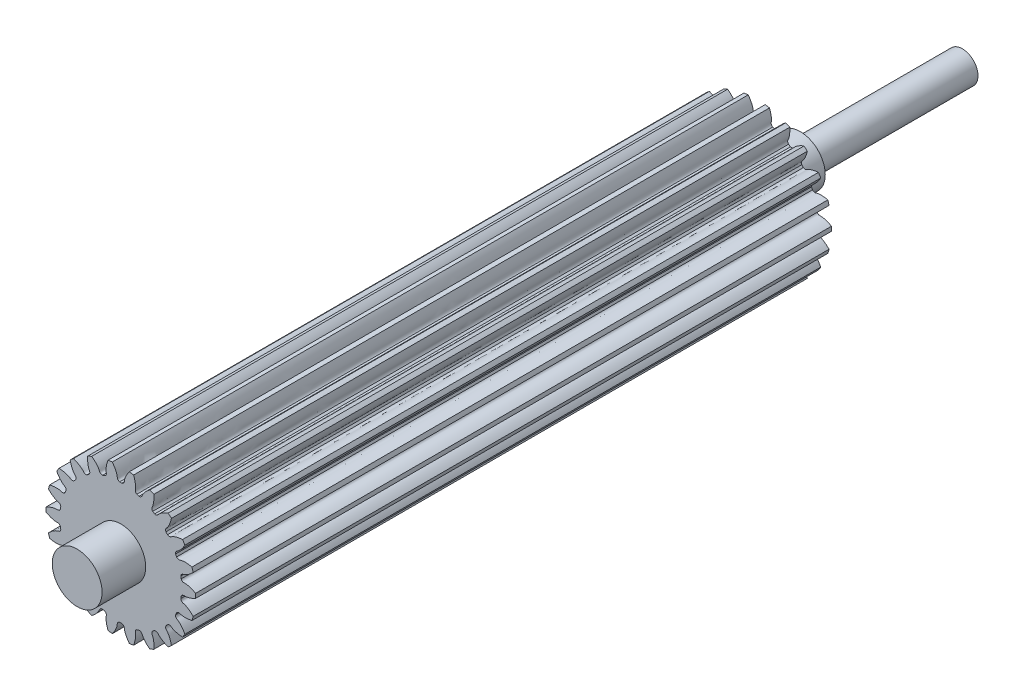
from build123d import *
from build123d.topology import SkipClean

# Parameters (mm, degrees)
SKETCH_1_R               = 12
EXTRUDE_1_DEPTH          = 30
CUT_EXTRUDE_1_DEPTH      = 35.467375879
PATTERN_CIRCULAR_1_COUNT = 22
EXTRUDE_START            = 72
EXTRUDE_2_DEPTH          = 72
SKETCH_19_R              = 4
EXTRUDE_3_DEPTH          = 7
EXTRUDE_START_2          = 7
SKETCH_20_R              = 4
EXTRUDE_4_DEPTH          = 7
SKETCH_21_R              = 2.5
EXTRUDE_5_DEPTH          = 26


with BuildPart() as part:
    # 草图1 → 凸台-拉伸1 (new body)
    with BuildSketch(Plane.XY):
        Circle(SKETCH_1_R)
    extrude(amount=EXTRUDE_1_DEPTH)

    # 草图2 → 切除-拉伸1 (cut, through all)
    with BuildSketch(Plane.XY):
        with BuildLine():
            ThreePointArc((0.185665431, 9.748232063), (0, 9.75), (-0.185665431, 9.748232063))
            add(Edge.make_bspline(
                [(-0.185665431, 9.748232063), (-0.588158706, 9.876186429), (-0.548347264, 10.151774696), (-0.599584047, 10.42157039), (-0.60596118, 10.451918903), (-0.613876897, 10.486162213), (-0.623483721, 10.524250431), (-0.634939934, 10.566127653), (-0.648399943, 10.611733662), (-0.664017171, 10.661003439), (-0.681942991, 10.713867378), (-0.70232689, 10.77025128), (-0.72531626, 10.830076418), (-0.751056303, 10.893259589), (-0.779689902, 10.959713172), (-0.811357505, 11.029345185), (-0.846197011, 11.10205935), (-0.884343649, 11.177755162), (-0.925929868, 11.25632795), (-0.971085225, 11.337668957), (-1.019936271, 11.421665408), (-1.072606448, 11.508200591), (-1.129215979, 11.597153935), (-1.189881763, 11.688401095), (-1.254717274, 11.781814033), (-1.323832459, 11.877261111), (-1.397333644, 11.974607178), (-1.475323431, 12.073713662), (-1.557900608, 12.174438668), (-1.64516006, 12.276637076), (-1.737192673, 12.380160638), (-1.834085256, 12.484858081), (-1.935920447, 12.590575215), (-2.042776642, 12.697155033), (-2.154727905, 12.804437827), (-2.271843904, 12.912261294), (-2.394189822, 13.020460649), (-2.521826308, 13.128868741), (-2.654809363, 13.237316171), (-2.841488127, 13.383435539), (-2.986445715, 13.489968103), (-3.085558798, 13.559868128)],
                knots=[0, 0, 0, 0, 0.157021319, 0.162530984, 0.168888289, 0.176093235, 0.184145822, 0.19304605, 0.202793918, 0.213389427, 0.224832576, 0.237123367, 0.250261798, 0.264247869, 0.279081582, 0.294762935, 0.311291928, 0.328668563, 0.346892838, 0.365964754, 0.38588431, 0.406651508, 0.428266346, 0.450728824, 0.474038944, 0.498196704, 0.523202104, 0.549055146, 0.575755828, 0.603304151, 0.631700114, 0.660943719, 0.691034964, 0.721973849, 0.753760376, 0.786394543, 0.819876351, 0.854205799, 0.889382888, 0.925407618, 1, 1, 1, 1], degree=3))
            ThreePointArc((-3.085558798, 13.559868128), (0, 13.906498364), (3.085558798, 13.559868128))
            add(Edge.make_bspline(
                [(0.185665431, 9.748232063), (0.588158706, 9.876186429), (0.548347264, 10.151774696), (0.599584047, 10.42157039), (0.60596118, 10.451918903), (0.613876897, 10.486162213), (0.623483721, 10.524250431), (0.634939934, 10.566127653), (0.648399943, 10.611733662), (0.664017171, 10.661003439), (0.681942991, 10.713867378), (0.70232689, 10.77025128), (0.72531626, 10.830076418), (0.751056303, 10.893259589), (0.779689902, 10.959713172), (0.811357505, 11.029345185), (0.846197011, 11.10205935), (0.884343649, 11.177755162), (0.925929868, 11.25632795), (0.971085225, 11.337668957), (1.019936271, 11.421665408), (1.072606448, 11.508200591), (1.129215979, 11.597153935), (1.189881763, 11.688401095), (1.254717274, 11.781814033), (1.323832459, 11.877261111), (1.397333644, 11.974607178), (1.475323431, 12.073713662), (1.557900608, 12.174438668), (1.64516006, 12.276637076), (1.737192673, 12.380160638), (1.834085256, 12.484858081), (1.935920447, 12.590575215), (2.042776642, 12.697155033), (2.154727905, 12.804437827), (2.271843904, 12.912261294), (2.394189822, 13.020460649), (2.521826308, 13.128868741), (2.654809363, 13.237316171), (2.841488127, 13.383435539), (2.986445715, 13.489968103), (3.085558798, 13.559868128)],
                knots=[0, 0, 0, 0, 0.157021319, 0.162530984, 0.168888289, 0.176093235, 0.184145822, 0.19304605, 0.202793918, 0.213389427, 0.224832576, 0.237123367, 0.250261798, 0.264247869, 0.279081582, 0.294762935, 0.311291928, 0.328668563, 0.346892838, 0.365964754, 0.38588431, 0.406651508, 0.428266346, 0.450728824, 0.474038944, 0.498196704, 0.523202104, 0.549055146, 0.575755828, 0.603304151, 0.631700114, 0.660943719, 0.691034964, 0.721973849, 0.753760376, 0.786394543, 0.819876351, 0.854205799, 0.889382888, 0.925407618, 1, 1, 1, 1], degree=3))
        make_face()
    cut_extrude_1 = extrude(amount=CUT_EXTRUDE_1_DEPTH, mode=Mode.SUBTRACT)

    # 阵列(圆周)1: 切除-拉伸1 ×22 about axis
    pattern_circular_1_axis = Axis((0, 0, -1.5), (0, 0, 1))
    for i in range(1, PATTERN_CIRCULAR_1_COUNT):
        add(cut_extrude_1.rotate(pattern_circular_1_axis, i * 360 / PATTERN_CIRCULAR_1_COUNT), mode=Mode.SUBTRACT)

    # 草图4 → 凸台-拉伸2 (add)
    with BuildSketch(Plane(origin=(0, 0, 0), x_dir=(-1, 0, 0), z_dir=(0, 0, -1)).offset(EXTRUDE_START)):
        with BuildLine():
            ThreePointArc((2.924539021, 9.301052173), (2.746892429, 9.355056493), (2.568249667, 9.405668166))
            add(Edge.make_bspline(
                [(2.568249667, 9.405668166), (2.218109108, 9.641834941), (2.333950094, 9.895043767), (2.361944393, 10.180005258), (2.365849304, 10.238460497), (2.368085913, 10.32113962), (2.366834845, 10.420382901), (2.360772595, 10.536017252), (2.34858845, 10.667790208), (2.32898426, 10.815370787), (2.300679804, 10.978350119), (2.26241667, 11.156242389), (2.212962422, 11.348485973), (2.151114634, 11.554444777), (2.096274933, 11.713680077), (2.062581682, 11.80433527), (2.055688884, 11.822611522)],
                knots=[0, 0, 0, 0, 0.157021319, 0.162530984, 0.176093235, 0.19304605, 0.213389427, 0.237123367, 0.264247869, 0.294762935, 0.328668563, 0.365964754, 0.406651508, 0.450728824, 0.498196704, 0.510209942, 0.510209942, 0.510209942, 0.510209942], degree=3))
            ThreePointArc((2.055688884, 11.822611522), (1.707778059, 11.877857303), (1.358395532, 11.922867171))
            add(Edge.make_bspline(
                [(1.358395532, 11.922867171), (1.300155371, 11.845656586), (1.201946581, 11.708817962), (1.073915974, 11.512256119), (0.972303664, 11.341732625), (0.885472389, 11.181826213), (0.812397844, 11.033422979), (0.752009469, 10.897343589), (0.703194045, 10.774341044), (0.670055832, 10.680054419), (0.644027119, 10.597938124), (0.627360159, 10.539619361), (0.611348785, 10.476138997), (0.60176986, 10.433080149), (0.548347264, 10.151774696), (0.588158706, 9.876186429), (0.185665431, 9.748232063)],
                knots=[0.489790058, 0.489790058, 0.489790058, 0.489790058, 0.549271176, 0.593348492, 0.634035246, 0.671331437, 0.705237065, 0.735752131, 0.762876633, 0.786610573, 0.797206082, 0.815854178, 0.823906765, 0.837469016, 0.842978681, 1, 1, 1, 1], degree=3))
            ThreePointArc((0.185665431, 9.748232063), (0, 9.75), (-0.185665431, 9.748232063))
            add(Edge.make_bspline(
                [(-0.185665431, 9.748232063), (-0.588158706, 9.876186429), (-0.548347264, 10.151774696), (-0.60176986, 10.433080149), (-0.61449187, 10.490267681), (-0.635639261, 10.570227844), (-0.664799714, 10.665098608), (-0.703194362, 10.774341023), (-0.752009695, 10.897343577), (-0.812398032, 11.033422968), (-0.885472542, 11.181826205), (-0.972303795, 11.341732617), (-1.073916075, 11.512256114), (-1.191283893, 11.692447604), (-1.288763969, 11.829782626), (-1.346632927, 11.907273161), (-1.358395532, 11.922867171)],
                knots=[0, 0, 0, 0, 0.157021319, 0.162530984, 0.176093235, 0.19304605, 0.213389427, 0.237123367, 0.264247869, 0.294762935, 0.328668563, 0.365964754, 0.406651508, 0.450728824, 0.498196704, 0.510209942, 0.510209942, 0.510209942, 0.510209942], degree=3))
            ThreePointArc((-1.358395532, 11.922867171), (-1.707778059, 11.877857303), (-2.055688884, 11.822611522))
            add(Edge.make_bspline(
                [(-2.055688884, 11.822611522), (-2.089817174, 11.732120359), (-2.145495923, 11.573156047), (-2.21296252, 11.34848595), (-2.262416797, 11.156242359), (-2.300679954, 10.978350084), (-2.328984444, 10.815370745), (-2.348588671, 10.667790156), (-2.360772906, 10.536017183), (-2.366005176, 10.436213716), (-2.36784471, 10.350090571), (-2.367406247, 10.289438503), (-2.364884562, 10.224018615), (-2.361944393, 10.180005258), (-2.333950094, 9.895043767), (-2.218109108, 9.641834941), (-2.568249667, 9.405668166)],
                knots=[0.489790058, 0.489790058, 0.489790058, 0.489790058, 0.549271176, 0.593348492, 0.634035246, 0.671331437, 0.705237065, 0.735752131, 0.762876633, 0.786610573, 0.797206082, 0.815854178, 0.823906765, 0.837469016, 0.842978681, 1, 1, 1, 1], degree=3))
            ThreePointArc((-2.568249667, 9.405668166), (-2.746892429, 9.355056493), (-2.924539021, 9.301052173))
            add(Edge.make_bspline(
                [(-2.924539021, 9.301052173), (-3.3467774, 9.310428028), (-3.386220788, 9.586069213), (-3.516732299, 9.840928935), (-3.545050567, 9.892215766), (-3.587868721, 9.962979072), (-3.642576155, 10.045791454), (-3.710192695, 10.139791761), (-3.791684488, 10.244058979), (-3.887964667, 10.357612838), (-3.999889169, 10.479417233), (-4.128253989, 10.608383121), (-4.273792278, 10.74337173), (-4.437171685, 10.883197863), (-4.569394878, 10.987506541), (-4.646751344, 11.045554595), (-4.662430821, 11.057203029)],
                knots=[0, 0, 0, 0, 0.157021319, 0.162530984, 0.176093235, 0.19304605, 0.213389427, 0.237123367, 0.264247869, 0.294762935, 0.328668563, 0.365964754, 0.406651508, 0.450728824, 0.498196704, 0.510209942, 0.510209942, 0.510209942, 0.510209942], degree=3))
            ThreePointArc((-4.662430821, 11.057203029), (-4.984980156, 10.915583944), (-5.303233613, 10.7645582))
            add(Edge.make_bspline(
                [(-5.303233613, 10.7645582), (-5.310485161, 10.668117515), (-5.319123107, 10.499905858), (-5.320559952, 10.265328941), (-5.313849705, 10.066939687), (-5.300444889, 9.885473322), (-5.281686262, 9.721121495), (-5.258918124, 9.573995807), (-5.233484075, 9.44412787), (-5.210386516, 9.346893044), (-5.187887842, 9.263740235), (-5.170379477, 9.205668531), (-5.149529026, 9.143609049), (-5.134307959, 9.102206883), (-5.027164697, 8.83667524), (-4.844678915, 8.626359328), (-5.114100451, 8.301112972)],
                knots=[0.489790058, 0.489790058, 0.489790058, 0.489790058, 0.549271176, 0.593348492, 0.634035246, 0.671331437, 0.705237065, 0.735752131, 0.762876633, 0.786610573, 0.797206082, 0.815854178, 0.823906765, 0.837469016, 0.842978681, 1, 1, 1, 1], degree=3))
            ThreePointArc((-5.114100451, 8.301112972), (-5.27124797, 8.202221945), (-5.426483851, 8.100356351))
            add(Edge.make_bspline(
                [(-5.426483851, 8.100356351), (-5.834260094, 7.99039412), (-5.949762843, 8.243757414), (-6.146790001, 8.451524185), (-6.188410351, 8.49275536), (-6.249430396, 8.548588987), (-6.325252738, 8.612634021), (-6.41661328, 8.683776874), (-6.524179553, 8.760861647), (-6.648551527, 8.842690515), (-6.790258564, 8.928028199), (-6.949757596, 9.015605514), (-7.127431248, 9.104123262), (-7.323586215, 9.192256156), (-7.479840591, 9.255088021), (-7.570417602, 9.288990887), (-7.588743694, 9.295750058)],
                knots=[0, 0, 0, 0, 0.157021319, 0.162530984, 0.176093235, 0.19304605, 0.213389427, 0.237123367, 0.264247869, 0.294762935, 0.328668563, 0.365964754, 0.406651508, 0.450728824, 0.498196704, 0.510209942, 0.510209942, 0.510209942, 0.510209942], degree=3))
            ThreePointArc((-7.588743694, 9.295750058), (-7.858328807, 9.068994892), (-8.121141894, 8.834424392))
            add(Edge.make_bspline(
                [(-8.121141894, 8.834424392), (-8.100929222, 8.739847235), (-8.061826571, 8.576015742), (-7.997117259, 8.350536032), (-7.934786112, 8.162073431), (-7.870799303, 7.991734302), (-7.806497272, 7.839324794), (-7.743201307, 7.704573257), (-7.68220949, 7.587131484), (-7.632653327, 7.500342686), (-7.587639155, 7.426896759), (-7.554479312, 7.376110043), (-7.516989274, 7.322438657), (-7.49072043, 7.287001839), (-7.313108313, 7.06241184), (-7.078761648, 6.912027385), (-7.245637231, 6.524050974)],
                knots=[0.489790058, 0.489790058, 0.489790058, 0.489790058, 0.549271176, 0.593348492, 0.634035246, 0.671331437, 0.705237065, 0.735752131, 0.762876633, 0.786610573, 0.797206082, 0.815854178, 0.823906765, 0.837469016, 0.842978681, 1, 1, 1, 1], degree=3))
            ThreePointArc((-7.245637231, 6.524050974), (-7.36855835, 6.384892156), (-7.488807233, 6.243417832))
            add(Edge.make_bspline(
                [(-7.488807233, 6.243417832), (-7.849085732, 6.023026001), (-8.031290497, 6.233585417), (-8.278871334, 6.377427208), (-8.330421932, 6.405262424), (-8.404700387, 6.441643063), (-8.495494963, 6.481732201), (-8.603198018, 6.52425403), (-8.728124391, 6.567911406), (-8.870512283, 6.611385996), (-9.030521594, 6.653343419), (-9.208233175, 6.692437167), (-9.403648127, 6.727312872), (-9.616687345, 6.756612524), (-9.784314102, 6.772877312), (-9.88077365, 6.77988838), (-9.900261685, 6.781210701)],
                knots=[0, 0, 0, 0, 0.157021319, 0.162530984, 0.176093235, 0.19304605, 0.213389427, 0.237123367, 0.264247869, 0.294762935, 0.328668563, 0.365964754, 0.406651508, 0.450728824, 0.498196704, 0.510209942, 0.510209942, 0.510209942, 0.510209942], degree=3))
            ThreePointArc((-9.900261685, 6.781210701), (-10.095042394, 6.487689809), (-10.281123557, 6.188578059))
            add(Edge.make_bspline(
                [(-10.281123557, 6.188578059), (-10.235084176, 6.103526509), (-10.151408791, 5.957347833), (-10.025795686, 5.759232356), (-9.912893339, 5.595964528), (-9.803508366, 5.450552498), (-9.698872299, 5.322432622), (-9.60017637, 5.210972003), (-9.508567979, 5.115470827), (-9.43656796, 5.046159169), (-9.372685068, 4.988370276), (-9.326560161, 4.948982987), (-9.275467756, 4.908047833), (-9.240279279, 4.881447244), (-9.006587387, 4.715993833), (-8.739365211, 4.637724091), (-8.790175575, 4.218449166)],
                knots=[0.489790058, 0.489790058, 0.489790058, 0.489790058, 0.549271176, 0.593348492, 0.634035246, 0.671331437, 0.705237065, 0.735752131, 0.762876633, 0.786610573, 0.797206082, 0.815854178, 0.823906765, 0.837469016, 0.842978681, 1, 1, 1, 1], degree=3))
            ThreePointArc((-8.790175575, 4.218449166), (-8.868911955, 4.050296377), (-8.94443199, 3.880674732))
            add(Edge.make_bspline(
                [(-8.94443199, 3.880674732), (-9.228025124, 3.567708136), (-9.462170759, 3.718405401), (-9.740247748, 3.786669007), (-9.797552271, 3.798853219), (-9.879071537, 3.812833528), (-9.97748271, 3.825718986), (-10.092802818, 3.836174925), (-10.2249685, 3.842868044), (-10.373836889, 3.844466303), (-10.53918547, 3.839644323), (-10.720712465, 3.827087362), (-10.91803736, 3.805495601), (-11.130701659, 3.773588328), (-11.296120675, 3.741968363), (-11.390648179, 3.721519639), (-11.409719353, 3.717297982)],
                knots=[0, 0, 0, 0, 0.157021319, 0.162530984, 0.176093235, 0.19304605, 0.213389427, 0.237123367, 0.264247869, 0.294762935, 0.328668563, 0.365964754, 0.406651508, 0.450728824, 0.498196704, 0.510209942, 0.510209942, 0.510209942, 0.510209942], degree=3))
            ThreePointArc((-11.409719353, 3.717297982), (-11.513915683, 3.380790682), (-11.608189734, 3.041369937))
            add(Edge.make_bspline(
                [(-11.608189734, 3.041369937), (-11.540053481, 2.972734366), (-11.418584245, 2.856051033), (-11.242243773, 2.701349926), (-11.087916901, 2.576503859), (-10.941995486, 2.467799346), (-10.805502374, 2.374348612), (-10.679402238, 2.295208787), (-10.564598841, 2.229385146), (-10.475987977, 2.183165848), (-10.398411779, 2.145715701), (-10.343058573, 2.120918762), (-10.282503004, 2.096036163), (-10.241245656, 2.080426825), (-9.970406315, 1.987514054), (-9.69195738, 1.987699973), (-9.62258617, 1.571093695)],
                knots=[0.489790058, 0.489790058, 0.489790058, 0.489790058, 0.549271176, 0.593348492, 0.634035246, 0.671331437, 0.705237065, 0.735752131, 0.762876633, 0.786610573, 0.797206082, 0.815854178, 0.823906765, 0.837469016, 0.842978681, 1, 1, 1, 1], degree=3))
            ThreePointArc((-9.62258617, 1.571093695), (-9.650759058, 1.387569673), (-9.675432062, 1.203542444))
            add(Edge.make_bspline(
                [(-9.675432062, 1.203542444), (-9.859364802, 0.823355776), (-10.126482219, 0.901982294), (-10.412527217, 0.889137403), (-10.470943193, 0.88468352), (-10.553099064, 0.875130897), (-10.651154146, 0.859768772), (-10.764748758, 0.837311742), (-10.893446471, 0.806498368), (-11.036734926, 0.766090814), (-11.194027219, 0.71488008), (-11.36466339, 0.651689699), (-11.547912138, 0.575379709), (-11.742972721, 0.484850449), (-11.892782731, 0.407907392), (-11.977720136, 0.361655509), (-11.994829415, 0.352231889)],
                knots=[0, 0, 0, 0, 0.157021319, 0.162530984, 0.176093235, 0.19304605, 0.213389427, 0.237123367, 0.264247869, 0.294762935, 0.328668563, 0.365964754, 0.406651508, 0.450728824, 0.498196704, 0.510209942, 0.510209942, 0.510209942, 0.510209942], degree=3))
            ThreePointArc((-11.994829415, 0.352231889), (-12, 0), (-11.994829415, -0.352231889))
            add(Edge.make_bspline(
                [(-11.994829415, -0.352231889), (-11.910116284, -0.398891037), (-11.760693911, -0.476626036), (-11.547912129, -0.57537981), (-11.364663379, -0.651689829), (-11.194027205, -0.714880233), (-11.03673491, -0.766091002), (-10.89344645, -0.806498594), (-10.764748734, -0.83731206), (-10.666705752, -0.856694587), (-10.58172101, -0.870771999), (-10.521623893, -0.878969688), (-10.456511011, -0.885783891), (-10.412527217, -0.889137403), (-10.126482219, -0.901982294), (-9.859364802, -0.823355776), (-9.675432062, -1.203542444)],
                knots=[0.489790058, 0.489790058, 0.489790058, 0.489790058, 0.549271176, 0.593348492, 0.634035246, 0.671331437, 0.705237065, 0.735752131, 0.762876633, 0.786610573, 0.797206082, 0.815854178, 0.823906765, 0.837469016, 0.842978681, 1, 1, 1, 1], degree=3))
            ThreePointArc((-9.675432062, -1.203542444), (-9.650759058, -1.387569673), (-9.62258617, -1.571093695))
            add(Edge.make_bspline(
                [(-9.62258617, -1.571093695), (-9.69195738, -1.987699973), (-9.970406315, -1.987514054), (-10.241245656, -2.080426825), (-10.296040571, -2.101157977), (-10.372177267, -2.133469636), (-10.461932418, -2.175834796), (-10.564598775, -2.229385458), (-10.679402194, -2.29520901), (-10.805502337, -2.374348797), (-10.941995455, -2.467799496), (-11.087916875, -2.576503987), (-11.242243753, -2.701350024), (-11.403897972, -2.843167131), (-11.52596226, -2.959199811), (-11.594428442, -3.027507799), (-11.608189734, -3.041369937)],
                knots=[0, 0, 0, 0, 0.157021319, 0.162530984, 0.176093235, 0.19304605, 0.213389427, 0.237123367, 0.264247869, 0.294762935, 0.328668563, 0.365964754, 0.406651508, 0.450728824, 0.498196704, 0.510209942, 0.510209942, 0.510209942, 0.510209942], degree=3))
            ThreePointArc((-11.608189734, -3.041369937), (-11.513915683, -3.380790682), (-11.409719353, -3.717297982))
            add(Edge.make_bspline(
                [(-11.409719353, -3.717297982), (-11.315292297, -3.73820066), (-11.150022101, -3.770689699), (-10.918037323, -3.805495695), (-10.720712418, -3.827087483), (-10.539185414, -3.839644466), (-10.373836821, -3.844466479), (-10.224968417, -3.842868255), (-10.092802706, -3.836175223), (-9.993270464, -3.827150722), (-9.907762136, -3.816714931), (-9.847789818, -3.807649241), (-9.783394683, -3.795843002), (-9.740247748, -3.786669007), (-9.462170759, -3.718405401), (-9.228025124, -3.567708136), (-8.94443199, -3.880674732)],
                knots=[0.489790058, 0.489790058, 0.489790058, 0.489790058, 0.549271176, 0.593348492, 0.634035246, 0.671331437, 0.705237065, 0.735752131, 0.762876633, 0.786610573, 0.797206082, 0.815854178, 0.823906765, 0.837469016, 0.842978681, 1, 1, 1, 1], degree=3))
            ThreePointArc((-8.94443199, -3.880674732), (-8.868911955, -4.050296377), (-8.790175575, -4.218449166))
            add(Edge.make_bspline(
                [(-8.790175575, -4.218449166), (-8.739365211, -4.637724091), (-9.006587387, -4.715993833), (-9.240279279, -4.881447244), (-9.287013975, -4.916776151), (-9.350963354, -4.969229146), (-9.425147146, -5.035165168), (-9.508567828, -5.115471107), (-9.600176265, -5.210972204), (-9.698872211, -5.322432789), (-9.803508295, -5.450552634), (-9.912893278, -5.595964644), (-10.02579564, -5.759232445), (-10.14094723, -5.940848218), (-10.225376874, -6.086570243), (-10.27182511, -6.171400431), (-10.281123557, -6.188578059)],
                knots=[0, 0, 0, 0, 0.157021319, 0.162530984, 0.176093235, 0.19304605, 0.213389427, 0.237123367, 0.264247869, 0.294762935, 0.328668563, 0.365964754, 0.406651508, 0.450728824, 0.498196704, 0.510209942, 0.510209942, 0.510209942, 0.510209942], degree=3))
            ThreePointArc((-10.281123557, -6.188578059), (-10.095042394, -6.487689809), (-9.900261685, -6.781210701))
            add(Edge.make_bspline(
                [(-9.900261685, -6.781210701), (-9.803770624, -6.774663498), (-9.636041811, -6.759274507), (-9.403648065, -6.727312951), (-9.208233095, -6.69243727), (-9.0305215, -6.65334354), (-8.870512168, -6.611386145), (-8.728124252, -6.567911585), (-8.603197826, -6.524254284), (-8.510239836, -6.487553866), (-8.431135298, -6.453450317), (-8.37614638, -6.427855698), (-8.317685902, -6.398385488), (-8.278871334, -6.377427208), (-8.031290497, -6.233585417), (-7.849085732, -6.023026001), (-7.488807233, -6.243417832)],
                knots=[0.489790058, 0.489790058, 0.489790058, 0.489790058, 0.549271176, 0.593348492, 0.634035246, 0.671331437, 0.705237065, 0.735752131, 0.762876633, 0.786610573, 0.797206082, 0.815854178, 0.823906765, 0.837469016, 0.842978681, 1, 1, 1, 1], degree=3))
            ThreePointArc((-7.488807233, -6.243417832), (-7.36855835, -6.384892156), (-7.245637231, -6.524050974))
            add(Edge.make_bspline(
                [(-7.245637231, -6.524050974), (-7.078761648, -6.912027385), (-7.313108313, -7.06241184), (-7.49072043, -7.287001839), (-7.525608738, -7.334066362), (-7.572190001, -7.402411265), (-7.624792505, -7.486576403), (-7.682209266, -7.58713171), (-7.743201149, -7.70457342), (-7.80649714, -7.83932493), (-7.870799196, -7.991734412), (-7.934786021, -8.162073525), (-7.997117189, -8.350536104), (-8.056437255, -8.557237115), (-8.096392266, -8.720842953), (-8.117059596, -8.815322902), (-8.121141894, -8.834424392)],
                knots=[0, 0, 0, 0, 0.157021319, 0.162530984, 0.176093235, 0.19304605, 0.213389427, 0.237123367, 0.264247869, 0.294762935, 0.328668563, 0.365964754, 0.406651508, 0.450728824, 0.498196704, 0.510209942, 0.510209942, 0.510209942, 0.510209942], degree=3))
            ThreePointArc((-8.121141894, -8.834424392), (-7.858328807, -9.068994892), (-7.588743694, -9.295750058))
            add(Edge.make_bspline(
                [(-7.588743694, -9.295750058), (-7.498005759, -9.262283389), (-7.341406722, -9.200263094), (-7.127431166, -9.104123321), (-6.94975749, -9.015605591), (-6.79025844, -8.928028289), (-6.648551375, -8.842690626), (-6.524179369, -8.760861779), (-6.416613024, -8.683777064), (-6.337760188, -8.622373978), (-6.271468019, -8.56736554), (-6.225917377, -8.527315513), (-6.178127677, -8.482568835), (-6.146790001, -8.451524185), (-5.949762843, -8.243757414), (-5.834260094, -7.99039412), (-5.426483851, -8.100356351)],
                knots=[0.489790058, 0.489790058, 0.489790058, 0.489790058, 0.549271176, 0.593348492, 0.634035246, 0.671331437, 0.705237065, 0.735752131, 0.762876633, 0.786610573, 0.797206082, 0.815854178, 0.823906765, 0.837469016, 0.842978681, 1, 1, 1, 1], degree=3))
            ThreePointArc((-5.426483851, -8.100356351), (-5.27124797, -8.202221945), (-5.114100451, -8.301112972))
            add(Edge.make_bspline(
                [(-5.114100451, -8.301112972), (-4.844678915, -8.626359328), (-5.027164697, -8.83667524), (-5.134307959, -9.102206883), (-5.154523438, -9.157194134), (-5.179962849, -9.235894046), (-5.206722521, -9.331469743), (-5.233483796, -9.444128024), (-5.258917927, -9.573995919), (-5.281686098, -9.721121587), (-5.300444756, -9.885473397), (-5.313849591, -10.066939751), (-5.320559864, -10.265328991), (-5.319242647, -10.480369552), (-5.311486107, -10.648604832), (-5.304698188, -10.745080339), (-5.303233613, -10.7645582)],
                knots=[0, 0, 0, 0, 0.157021319, 0.162530984, 0.176093235, 0.19304605, 0.213389427, 0.237123367, 0.264247869, 0.294762935, 0.328668563, 0.365964754, 0.406651508, 0.450728824, 0.498196704, 0.510209942, 0.510209942, 0.510209942, 0.510209942], degree=3))
            ThreePointArc((-5.303233613, -10.7645582), (-4.984980156, -10.915583944), (-4.662430821, -11.057203029))
            add(Edge.make_bspline(
                [(-4.662430821, -11.057203029), (-4.584797061, -10.999528165), (-4.452014522, -10.89590108), (-4.273792183, -10.743371764), (-4.128253866, -10.608383165), (-3.999889025, -10.479417284), (-3.887964489, -10.357612901), (-3.791684274, -10.244059055), (-3.710192396, -10.139791871), (-3.651832902, -10.05866063), (-3.6037237, -9.987203758), (-3.571301575, -9.93594294), (-3.538054289, -9.879544902), (-3.516732299, -9.840928935), (-3.386220788, -9.586069213), (-3.3467774, -9.310428028), (-2.924539021, -9.301052173)],
                knots=[0.489790058, 0.489790058, 0.489790058, 0.489790058, 0.549271176, 0.593348492, 0.634035246, 0.671331437, 0.705237065, 0.735752131, 0.762876633, 0.786610573, 0.797206082, 0.815854178, 0.823906765, 0.837469016, 0.842978681, 1, 1, 1, 1], degree=3))
            ThreePointArc((-2.924539021, -9.301052173), (-2.746892429, -9.355056493), (-2.568249667, -9.405668166))
            add(Edge.make_bspline(
                [(-2.568249667, -9.405668166), (-2.218109108, -9.641834941), (-2.333950094, -9.895043767), (-2.361944393, -10.180005258), (-2.365849304, -10.238460497), (-2.368085913, -10.32113962), (-2.366834845, -10.420382901), (-2.360772595, -10.536017252), (-2.34858845, -10.667790208), (-2.32898426, -10.815370787), (-2.300679804, -10.978350119), (-2.26241667, -11.156242389), (-2.212962422, -11.348485973), (-2.151114634, -11.554444777), (-2.096274933, -11.713680077), (-2.062581682, -11.80433527), (-2.055688884, -11.822611522)],
                knots=[0, 0, 0, 0, 0.157021319, 0.162530984, 0.176093235, 0.19304605, 0.213389427, 0.237123367, 0.264247869, 0.294762935, 0.328668563, 0.365964754, 0.406651508, 0.450728824, 0.498196704, 0.510209942, 0.510209942, 0.510209942, 0.510209942], degree=3))
            ThreePointArc((-2.055688884, -11.822611522), (-1.707778059, -11.877857303), (-1.358395532, -11.922867171))
            add(Edge.make_bspline(
                [(-1.358395532, -11.922867171), (-1.300155371, -11.845656586), (-1.201946581, -11.708817962), (-1.073915974, -11.512256119), (-0.972303664, -11.341732625), (-0.885472389, -11.181826213), (-0.812397844, -11.033422979), (-0.752009469, -10.897343589), (-0.703194045, -10.774341044), (-0.670055832, -10.680054419), (-0.644027119, -10.597938124), (-0.627360159, -10.539619361), (-0.611348785, -10.476138997), (-0.60176986, -10.433080149), (-0.548347264, -10.151774696), (-0.588158706, -9.876186429), (-0.185665431, -9.748232063)],
                knots=[0.489790058, 0.489790058, 0.489790058, 0.489790058, 0.549271176, 0.593348492, 0.634035246, 0.671331437, 0.705237065, 0.735752131, 0.762876633, 0.786610573, 0.797206082, 0.815854178, 0.823906765, 0.837469016, 0.842978681, 1, 1, 1, 1], degree=3))
            ThreePointArc((-0.185665431, -9.748232063), (0, -9.75), (0.185665431, -9.748232063))
            add(Edge.make_bspline(
                [(0.185665431, -9.748232063), (0.588158706, -9.876186429), (0.548347264, -10.151774696), (0.60176986, -10.433080149), (0.61449187, -10.490267681), (0.635639261, -10.570227844), (0.664799714, -10.665098608), (0.703194362, -10.774341023), (0.752009695, -10.897343577), (0.812398032, -11.033422968), (0.885472542, -11.181826205), (0.972303795, -11.341732617), (1.073916075, -11.512256114), (1.191283893, -11.692447604), (1.288763969, -11.829782626), (1.346632927, -11.907273161), (1.358395532, -11.922867171)],
                knots=[0, 0, 0, 0, 0.157021319, 0.162530984, 0.176093235, 0.19304605, 0.213389427, 0.237123367, 0.264247869, 0.294762935, 0.328668563, 0.365964754, 0.406651508, 0.450728824, 0.498196704, 0.510209942, 0.510209942, 0.510209942, 0.510209942], degree=3))
            ThreePointArc((1.358395532, -11.922867171), (1.707778059, -11.877857303), (2.055688884, -11.822611522))
            add(Edge.make_bspline(
                [(2.055688884, -11.822611522), (2.089817174, -11.732120359), (2.145495923, -11.573156047), (2.21296252, -11.34848595), (2.262416797, -11.156242359), (2.300679954, -10.978350084), (2.328984444, -10.815370745), (2.348588671, -10.667790156), (2.360772906, -10.536017183), (2.366005176, -10.436213716), (2.36784471, -10.350090571), (2.367406247, -10.289438503), (2.364884562, -10.224018615), (2.361944393, -10.180005258), (2.333950094, -9.895043767), (2.218109108, -9.641834941), (2.568249667, -9.405668166)],
                knots=[0.489790058, 0.489790058, 0.489790058, 0.489790058, 0.549271176, 0.593348492, 0.634035246, 0.671331437, 0.705237065, 0.735752131, 0.762876633, 0.786610573, 0.797206082, 0.815854178, 0.823906765, 0.837469016, 0.842978681, 1, 1, 1, 1], degree=3))
            ThreePointArc((2.568249667, -9.405668166), (2.746892429, -9.355056493), (2.924539021, -9.301052173))
            add(Edge.make_bspline(
                [(2.924539021, -9.301052173), (3.3467774, -9.310428028), (3.386220788, -9.586069213), (3.516732299, -9.840928935), (3.545050567, -9.892215766), (3.587868721, -9.962979072), (3.642576155, -10.045791454), (3.710192695, -10.139791761), (3.791684488, -10.244058979), (3.887964667, -10.357612838), (3.999889169, -10.479417233), (4.128253989, -10.608383121), (4.273792278, -10.74337173), (4.437171685, -10.883197863), (4.569394878, -10.987506541), (4.646751344, -11.045554595), (4.662430821, -11.057203029)],
                knots=[0, 0, 0, 0, 0.157021319, 0.162530984, 0.176093235, 0.19304605, 0.213389427, 0.237123367, 0.264247869, 0.294762935, 0.328668563, 0.365964754, 0.406651508, 0.450728824, 0.498196704, 0.510209942, 0.510209942, 0.510209942, 0.510209942], degree=3))
            ThreePointArc((4.662430821, -11.057203029), (4.984980156, -10.915583944), (5.303233613, -10.7645582))
            add(Edge.make_bspline(
                [(5.303233613, -10.7645582), (5.310485161, -10.668117515), (5.319123107, -10.499905858), (5.320559952, -10.265328941), (5.313849705, -10.066939687), (5.300444889, -9.885473322), (5.281686262, -9.721121495), (5.258918124, -9.573995807), (5.233484075, -9.44412787), (5.210386516, -9.346893044), (5.187887842, -9.263740235), (5.170379477, -9.205668531), (5.149529026, -9.143609049), (5.134307959, -9.102206883), (5.027164697, -8.83667524), (4.844678915, -8.626359328), (5.114100451, -8.301112972)],
                knots=[0.489790058, 0.489790058, 0.489790058, 0.489790058, 0.549271176, 0.593348492, 0.634035246, 0.671331437, 0.705237065, 0.735752131, 0.762876633, 0.786610573, 0.797206082, 0.815854178, 0.823906765, 0.837469016, 0.842978681, 1, 1, 1, 1], degree=3))
            ThreePointArc((5.114100451, -8.301112972), (5.27124797, -8.202221945), (5.426483851, -8.100356351))
            add(Edge.make_bspline(
                [(5.426483851, -8.100356351), (5.834260094, -7.99039412), (5.949762843, -8.243757414), (6.146790001, -8.451524185), (6.188410351, -8.49275536), (6.249430396, -8.548588987), (6.325252738, -8.612634021), (6.41661328, -8.683776874), (6.524179553, -8.760861647), (6.648551527, -8.842690515), (6.790258564, -8.928028199), (6.949757596, -9.015605514), (7.127431248, -9.104123262), (7.323586215, -9.192256156), (7.479840591, -9.255088021), (7.570417602, -9.288990887), (7.588743694, -9.295750058)],
                knots=[0, 0, 0, 0, 0.157021319, 0.162530984, 0.176093235, 0.19304605, 0.213389427, 0.237123367, 0.264247869, 0.294762935, 0.328668563, 0.365964754, 0.406651508, 0.450728824, 0.498196704, 0.510209942, 0.510209942, 0.510209942, 0.510209942], degree=3))
            ThreePointArc((7.588743694, -9.295750058), (7.858328807, -9.068994892), (8.121141894, -8.834424392))
            add(Edge.make_bspline(
                [(8.121141894, -8.834424392), (8.100929222, -8.739847235), (8.061826571, -8.576015742), (7.997117259, -8.350536032), (7.934786112, -8.162073431), (7.870799303, -7.991734302), (7.806497272, -7.839324794), (7.743201307, -7.704573257), (7.68220949, -7.587131484), (7.632653327, -7.500342686), (7.587639155, -7.426896759), (7.554479312, -7.376110043), (7.516989274, -7.322438657), (7.49072043, -7.287001839), (7.313108313, -7.06241184), (7.078761648, -6.912027385), (7.245637231, -6.524050974)],
                knots=[0.489790058, 0.489790058, 0.489790058, 0.489790058, 0.549271176, 0.593348492, 0.634035246, 0.671331437, 0.705237065, 0.735752131, 0.762876633, 0.786610573, 0.797206082, 0.815854178, 0.823906765, 0.837469016, 0.842978681, 1, 1, 1, 1], degree=3))
            ThreePointArc((7.245637231, -6.524050974), (7.36855835, -6.384892156), (7.488807233, -6.243417832))
            add(Edge.make_bspline(
                [(7.488807233, -6.243417832), (7.849085732, -6.023026001), (8.031290497, -6.233585417), (8.278871334, -6.377427208), (8.330421932, -6.405262424), (8.404700387, -6.441643063), (8.495494963, -6.481732201), (8.603198018, -6.52425403), (8.728124391, -6.567911406), (8.870512283, -6.611385996), (9.030521594, -6.653343419), (9.208233175, -6.692437167), (9.403648127, -6.727312872), (9.616687345, -6.756612524), (9.784314102, -6.772877312), (9.88077365, -6.77988838), (9.900261685, -6.781210701)],
                knots=[0, 0, 0, 0, 0.157021319, 0.162530984, 0.176093235, 0.19304605, 0.213389427, 0.237123367, 0.264247869, 0.294762935, 0.328668563, 0.365964754, 0.406651508, 0.450728824, 0.498196704, 0.510209942, 0.510209942, 0.510209942, 0.510209942], degree=3))
            ThreePointArc((9.900261685, -6.781210701), (10.095042394, -6.487689809), (10.281123557, -6.188578059))
            add(Edge.make_bspline(
                [(10.281123557, -6.188578059), (10.235084176, -6.103526509), (10.151408791, -5.957347833), (10.025795686, -5.759232356), (9.912893339, -5.595964528), (9.803508366, -5.450552498), (9.698872299, -5.322432622), (9.60017637, -5.210972003), (9.508567979, -5.115470827), (9.43656796, -5.046159169), (9.372685068, -4.988370276), (9.326560161, -4.948982987), (9.275467756, -4.908047833), (9.240279279, -4.881447244), (9.006587387, -4.715993833), (8.739365211, -4.637724091), (8.790175575, -4.218449166)],
                knots=[0.489790058, 0.489790058, 0.489790058, 0.489790058, 0.549271176, 0.593348492, 0.634035246, 0.671331437, 0.705237065, 0.735752131, 0.762876633, 0.786610573, 0.797206082, 0.815854178, 0.823906765, 0.837469016, 0.842978681, 1, 1, 1, 1], degree=3))
            ThreePointArc((8.790175575, -4.218449166), (8.868911955, -4.050296377), (8.94443199, -3.880674732))
            add(Edge.make_bspline(
                [(8.94443199, -3.880674732), (9.228025124, -3.567708136), (9.462170759, -3.718405401), (9.740247748, -3.786669007), (9.797552271, -3.798853219), (9.879071537, -3.812833528), (9.97748271, -3.825718986), (10.092802818, -3.836174925), (10.2249685, -3.842868044), (10.373836889, -3.844466303), (10.53918547, -3.839644323), (10.720712465, -3.827087362), (10.91803736, -3.805495601), (11.130701659, -3.773588328), (11.296120675, -3.741968363), (11.390648179, -3.721519639), (11.409719353, -3.717297982)],
                knots=[0, 0, 0, 0, 0.157021319, 0.162530984, 0.176093235, 0.19304605, 0.213389427, 0.237123367, 0.264247869, 0.294762935, 0.328668563, 0.365964754, 0.406651508, 0.450728824, 0.498196704, 0.510209942, 0.510209942, 0.510209942, 0.510209942], degree=3))
            ThreePointArc((11.409719353, -3.717297982), (11.513915683, -3.380790682), (11.608189734, -3.041369937))
            add(Edge.make_bspline(
                [(11.608189734, -3.041369937), (11.540053481, -2.972734366), (11.418584245, -2.856051033), (11.242243773, -2.701349926), (11.087916901, -2.576503859), (10.941995486, -2.467799346), (10.805502374, -2.374348612), (10.679402238, -2.295208787), (10.564598841, -2.229385146), (10.475987977, -2.183165848), (10.398411779, -2.145715701), (10.343058573, -2.120918762), (10.282503004, -2.096036163), (10.241245656, -2.080426825), (9.970406315, -1.987514054), (9.69195738, -1.987699973), (9.62258617, -1.571093695)],
                knots=[0.489790058, 0.489790058, 0.489790058, 0.489790058, 0.549271176, 0.593348492, 0.634035246, 0.671331437, 0.705237065, 0.735752131, 0.762876633, 0.786610573, 0.797206082, 0.815854178, 0.823906765, 0.837469016, 0.842978681, 1, 1, 1, 1], degree=3))
            ThreePointArc((9.62258617, -1.571093695), (9.650759058, -1.387569673), (9.675432062, -1.203542444))
            add(Edge.make_bspline(
                [(9.675432062, -1.203542444), (9.859364802, -0.823355776), (10.126482219, -0.901982294), (10.412527217, -0.889137403), (10.470943193, -0.88468352), (10.553099064, -0.875130897), (10.651154146, -0.859768772), (10.764748758, -0.837311742), (10.893446471, -0.806498368), (11.036734926, -0.766090814), (11.194027219, -0.71488008), (11.36466339, -0.651689699), (11.547912138, -0.575379709), (11.742972721, -0.484850449), (11.892782731, -0.407907392), (11.977720136, -0.361655509), (11.994829415, -0.352231889)],
                knots=[0, 0, 0, 0, 0.157021319, 0.162530984, 0.176093235, 0.19304605, 0.213389427, 0.237123367, 0.264247869, 0.294762935, 0.328668563, 0.365964754, 0.406651508, 0.450728824, 0.498196704, 0.510209942, 0.510209942, 0.510209942, 0.510209942], degree=3))
            ThreePointArc((11.994829415, -0.352231889), (12, 0), (11.994829415, 0.352231889))
            add(Edge.make_bspline(
                [(11.994829415, 0.352231889), (11.910116284, 0.398891037), (11.760693911, 0.476626036), (11.547912129, 0.57537981), (11.364663379, 0.651689829), (11.194027205, 0.714880233), (11.03673491, 0.766091002), (10.89344645, 0.806498594), (10.764748734, 0.83731206), (10.666705752, 0.856694587), (10.58172101, 0.870771999), (10.521623893, 0.878969688), (10.456511011, 0.885783891), (10.412527217, 0.889137403), (10.126482219, 0.901982294), (9.859364802, 0.823355776), (9.675432062, 1.203542444)],
                knots=[0.489790058, 0.489790058, 0.489790058, 0.489790058, 0.549271176, 0.593348492, 0.634035246, 0.671331437, 0.705237065, 0.735752131, 0.762876633, 0.786610573, 0.797206082, 0.815854178, 0.823906765, 0.837469016, 0.842978681, 1, 1, 1, 1], degree=3))
            ThreePointArc((9.675432062, 1.203542444), (9.650759058, 1.387569673), (9.62258617, 1.571093695))
            add(Edge.make_bspline(
                [(9.62258617, 1.571093695), (9.69195738, 1.987699973), (9.970406315, 1.987514054), (10.241245656, 2.080426825), (10.296040571, 2.101157977), (10.372177267, 2.133469636), (10.461932418, 2.175834796), (10.564598775, 2.229385458), (10.679402194, 2.29520901), (10.805502337, 2.374348797), (10.941995455, 2.467799496), (11.087916875, 2.576503987), (11.242243753, 2.701350024), (11.403897972, 2.843167131), (11.52596226, 2.959199811), (11.594428442, 3.027507799), (11.608189734, 3.041369937)],
                knots=[0, 0, 0, 0, 0.157021319, 0.162530984, 0.176093235, 0.19304605, 0.213389427, 0.237123367, 0.264247869, 0.294762935, 0.328668563, 0.365964754, 0.406651508, 0.450728824, 0.498196704, 0.510209942, 0.510209942, 0.510209942, 0.510209942], degree=3))
            ThreePointArc((11.608189734, 3.041369937), (11.513915683, 3.380790682), (11.409719353, 3.717297982))
            add(Edge.make_bspline(
                [(11.409719353, 3.717297982), (11.315292297, 3.73820066), (11.150022101, 3.770689699), (10.918037323, 3.805495695), (10.720712418, 3.827087483), (10.539185414, 3.839644466), (10.373836821, 3.844466479), (10.224968417, 3.842868255), (10.092802706, 3.836175223), (9.993270464, 3.827150722), (9.907762136, 3.816714931), (9.847789818, 3.807649241), (9.783394683, 3.795843002), (9.740247748, 3.786669007), (9.462170759, 3.718405401), (9.228025124, 3.567708136), (8.94443199, 3.880674732)],
                knots=[0.489790058, 0.489790058, 0.489790058, 0.489790058, 0.549271176, 0.593348492, 0.634035246, 0.671331437, 0.705237065, 0.735752131, 0.762876633, 0.786610573, 0.797206082, 0.815854178, 0.823906765, 0.837469016, 0.842978681, 1, 1, 1, 1], degree=3))
            ThreePointArc((8.94443199, 3.880674732), (8.868911955, 4.050296377), (8.790175575, 4.218449166))
            add(Edge.make_bspline(
                [(8.790175575, 4.218449166), (8.739365211, 4.637724091), (9.006587387, 4.715993833), (9.240279279, 4.881447244), (9.287013975, 4.916776151), (9.350963354, 4.969229146), (9.425147146, 5.035165168), (9.508567828, 5.115471107), (9.600176265, 5.210972204), (9.698872211, 5.322432789), (9.803508295, 5.450552634), (9.912893278, 5.595964644), (10.02579564, 5.759232445), (10.14094723, 5.940848218), (10.225376874, 6.086570243), (10.27182511, 6.171400431), (10.281123557, 6.188578059)],
                knots=[0, 0, 0, 0, 0.157021319, 0.162530984, 0.176093235, 0.19304605, 0.213389427, 0.237123367, 0.264247869, 0.294762935, 0.328668563, 0.365964754, 0.406651508, 0.450728824, 0.498196704, 0.510209942, 0.510209942, 0.510209942, 0.510209942], degree=3))
            ThreePointArc((10.281123557, 6.188578059), (10.095042394, 6.487689809), (9.900261685, 6.781210701))
            add(Edge.make_bspline(
                [(9.900261685, 6.781210701), (9.803770624, 6.774663498), (9.636041811, 6.759274507), (9.403648065, 6.727312951), (9.208233095, 6.69243727), (9.0305215, 6.65334354), (8.870512168, 6.611386145), (8.728124252, 6.567911585), (8.603197826, 6.524254284), (8.510239836, 6.487553866), (8.431135298, 6.453450317), (8.37614638, 6.427855698), (8.317685902, 6.398385488), (8.278871334, 6.377427208), (8.031290497, 6.233585417), (7.849085732, 6.023026001), (7.488807233, 6.243417832)],
                knots=[0.489790058, 0.489790058, 0.489790058, 0.489790058, 0.549271176, 0.593348492, 0.634035246, 0.671331437, 0.705237065, 0.735752131, 0.762876633, 0.786610573, 0.797206082, 0.815854178, 0.823906765, 0.837469016, 0.842978681, 1, 1, 1, 1], degree=3))
            ThreePointArc((7.488807233, 6.243417832), (7.36855835, 6.384892156), (7.245637231, 6.524050974))
            add(Edge.make_bspline(
                [(7.245637231, 6.524050974), (7.078761648, 6.912027385), (7.313108313, 7.06241184), (7.49072043, 7.287001839), (7.525608738, 7.334066362), (7.572190001, 7.402411265), (7.624792505, 7.486576403), (7.682209266, 7.58713171), (7.743201149, 7.70457342), (7.80649714, 7.83932493), (7.870799196, 7.991734412), (7.934786021, 8.162073525), (7.997117189, 8.350536104), (8.056437255, 8.557237115), (8.096392266, 8.720842953), (8.117059596, 8.815322902), (8.121141894, 8.834424392)],
                knots=[0, 0, 0, 0, 0.157021319, 0.162530984, 0.176093235, 0.19304605, 0.213389427, 0.237123367, 0.264247869, 0.294762935, 0.328668563, 0.365964754, 0.406651508, 0.450728824, 0.498196704, 0.510209942, 0.510209942, 0.510209942, 0.510209942], degree=3))
            ThreePointArc((8.121141894, 8.834424392), (7.858328807, 9.068994892), (7.588743694, 9.295750058))
            add(Edge.make_bspline(
                [(7.588743694, 9.295750058), (7.498005759, 9.262283389), (7.341406722, 9.200263094), (7.127431166, 9.104123321), (6.94975749, 9.015605591), (6.79025844, 8.928028289), (6.648551375, 8.842690626), (6.524179369, 8.760861779), (6.416613024, 8.683777064), (6.337760188, 8.622373978), (6.271468019, 8.56736554), (6.225917377, 8.527315513), (6.178127677, 8.482568835), (6.146790001, 8.451524185), (5.949762843, 8.243757414), (5.834260094, 7.99039412), (5.426483851, 8.100356351)],
                knots=[0.489790058, 0.489790058, 0.489790058, 0.489790058, 0.549271176, 0.593348492, 0.634035246, 0.671331437, 0.705237065, 0.735752131, 0.762876633, 0.786610573, 0.797206082, 0.815854178, 0.823906765, 0.837469016, 0.842978681, 1, 1, 1, 1], degree=3))
            ThreePointArc((5.426483851, 8.100356351), (5.27124797, 8.202221945), (5.114100451, 8.301112972))
            add(Edge.make_bspline(
                [(5.114100451, 8.301112972), (4.844678915, 8.626359328), (5.027164697, 8.83667524), (5.134307959, 9.102206883), (5.154523438, 9.157194134), (5.179962849, 9.235894046), (5.206722521, 9.331469743), (5.233483796, 9.444128024), (5.258917927, 9.573995919), (5.281686098, 9.721121587), (5.300444756, 9.885473397), (5.313849591, 10.066939751), (5.320559864, 10.265328991), (5.319242647, 10.480369552), (5.311486107, 10.648604832), (5.304698188, 10.745080339), (5.303233613, 10.7645582)],
                knots=[0, 0, 0, 0, 0.157021319, 0.162530984, 0.176093235, 0.19304605, 0.213389427, 0.237123367, 0.264247869, 0.294762935, 0.328668563, 0.365964754, 0.406651508, 0.450728824, 0.498196704, 0.510209942, 0.510209942, 0.510209942, 0.510209942], degree=3))
            ThreePointArc((5.303233613, 10.7645582), (4.984980156, 10.915583944), (4.662430821, 11.057203029))
            add(Edge.make_bspline(
                [(4.662430821, 11.057203029), (4.584797061, 10.999528165), (4.452014522, 10.89590108), (4.273792183, 10.743371764), (4.128253866, 10.608383165), (3.999889025, 10.479417284), (3.887964489, 10.357612901), (3.791684274, 10.244059055), (3.710192396, 10.139791871), (3.651832902, 10.05866063), (3.6037237, 9.987203758), (3.571301575, 9.93594294), (3.538054289, 9.879544902), (3.516732299, 9.840928935), (3.386220788, 9.586069213), (3.3467774, 9.310428028), (2.924539021, 9.301052173)],
                knots=[0.489790058, 0.489790058, 0.489790058, 0.489790058, 0.549271176, 0.593348492, 0.634035246, 0.671331437, 0.705237065, 0.735752131, 0.762876633, 0.786610573, 0.797206082, 0.815854178, 0.823906765, 0.837469016, 0.842978681, 1, 1, 1, 1], degree=3))
        make_face()
    extrude(amount=-EXTRUDE_2_DEPTH)

    # 草图19 → 凸台-拉伸3 (add)
    with SkipClean():  # the faces are left unmerged after this step: merging them gives an invalid solid
        with BuildSketch(Plane(origin=(0, 0, -72), x_dir=(-1, 0, 0), z_dir=(0, 0, -1))):
            Circle(SKETCH_19_R)
        extrude(amount=EXTRUDE_3_DEPTH)

    # 草图20 → 凸台-拉伸4 (add)
    with SkipClean():  # the faces are left unmerged after this step: merging them gives an invalid solid
        with BuildSketch(Plane.XY.offset(30).offset(EXTRUDE_START_2)):
            Circle(SKETCH_20_R)
        extrude(amount=-EXTRUDE_4_DEPTH)

    # 草图21 → 凸台-拉伸5 (add)
    with SkipClean():  # the faces are left unmerged after this step: merging them gives an invalid solid
        with BuildSketch(Plane(origin=(0, 0, -79), x_dir=(-1, 0, 0), z_dir=(0, 0, -1))):
            Circle(SKETCH_21_R)
        extrude(amount=EXTRUDE_5_DEPTH)


solid = part.part
